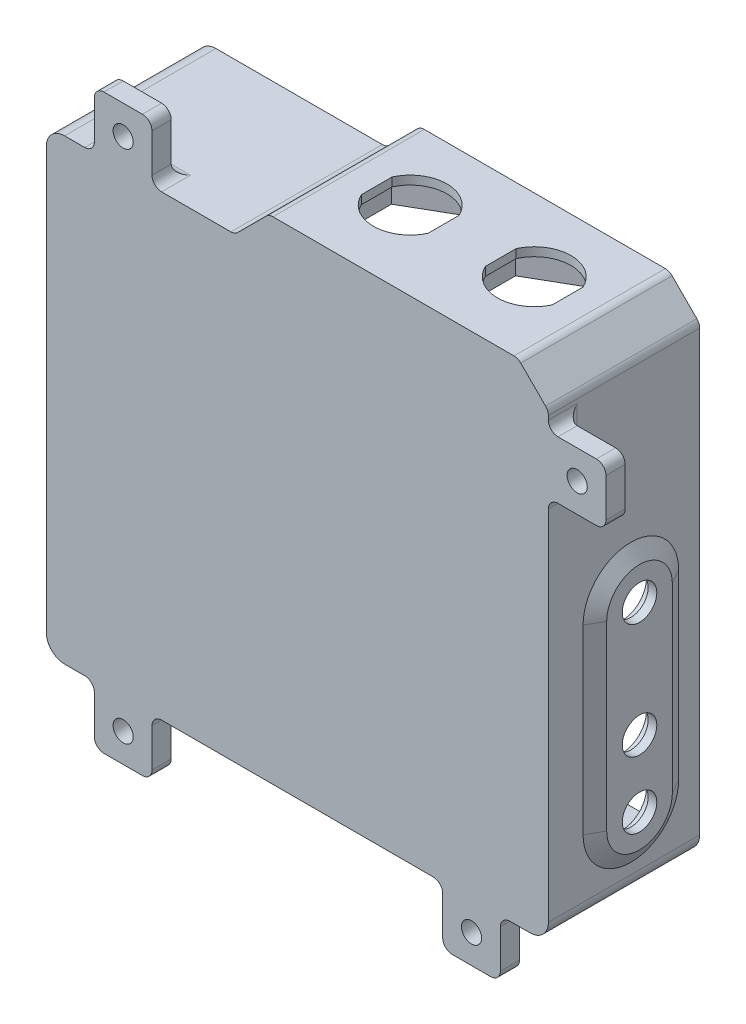
from build123d import *
from OCP.BRepFilletAPI import BRepFilletAPI_MakeChamfer

# Parameters (mm, degrees)
BOSS_EXTRUDE1_DEPTH     = 1.5
BOSS_EXTRUDE2_START     = -1.5
BOSS_EXTRUDE2_DEPTH     = 1.5
FILLET1_R               = 2
BOSS_EXTRUDE3_DEPTH     = 30
SKETCH5_R               = 5.032
SKETCH5_R_2             = 4.832
CUT_EXTRUDE1_DEPTH      = 10
BOSS_EXTRUDE4_START     = 1.8
SKETCH6_R               = 5.032
SKETCH6_R_2             = 3.597
BOSS_EXTRUDE4_DEPTH     = 1.8
CHAMFER1_SIZE           = 3.117691454
CHAMFER1_SIZE_2         = 1.8
CUT_EXTRUDE2_DEPTH      = 11.8
BOSS_EXTRUDE5_OUTLINE_W = 50.173145751
BOSS_EXTRUDE5_OUTLINE_H = 30
BOSS_EXTRUDE5_DEPTH     = 5.3
BOSS_EXTRUDE6_START     = -30
BOSS_EXTRUDE6_DEPTH     = 30
FILLET2_R               = 2
SKETCH10_R              = 2.85
SKETCH10_R_2            = 1.5
BOSS_EXTRUDE7_DEPTH     = 9
CHAMFER2_SIZE           = 2
SKETCH11_R              = 2.85
SKETCH11_R_2            = 1.5
BOSS_EXTRUDE8_DEPTH     = 30
FILLET3_R               = 2
SKETCH12_W              = 12
SKETCH12_H              = 12
SKETCH12_R              = 2.1
BOSS_EXTRUDE9_DEPTH     = 4
FILLET4_R               = 2
FILLET5_R               = 2


# Read off the part's stored shape, not the designer's step: Boss-Extrude5
# Some blends are built 0.0001 mm under size
with BuildPart() as part:
    # Sketch1 → Boss-Extrude1 (new body)
    with BuildSketch(Plane.XY):
        with BuildLine():
            Line((-71.515147012, 38.673979945), (-31.595147012, 38.673979945))
            Line((-31.595147012, 38.673979945), (25.404852988, 38.673979945))
            ThreePointArc((25.404852988, 38.673979945), (28.091858756, 37.560985714), (29.204852988, 34.873979945))
            Line((29.204852988, 34.873979945), (29.204852988, -31.776020055))
            Line((29.204852988, -31.776020055), (29.204852988, -46.156020055))
            Line((29.204852988, -46.156020055), (29.204852988, -52.766020055))
            ThreePointArc((29.204852988, -52.766020055), (28.091858756, -55.453025824), (25.404852988, -56.566020055))
            Line((25.404852988, -56.566020055), (-31.595147012, -56.566020055))
            Line((-31.595147012, -56.566020055), (-71.515147012, -56.566020055))
            ThreePointArc((-71.515147012, -56.566020055), (-74.202152781, -55.453025824), (-75.315147012, -52.766020055))
            Line((-75.315147012, -52.766020055), (-75.315147012, 34.873979945))
            ThreePointArc((-75.315147012, 34.873979945), (-74.202152781, 37.560985714), (-71.515147012, 38.673979945))
        make_face()
    extrude(amount=BOSS_EXTRUDE1_DEPTH)

    # Sketch2 → Boss-Extrude2 (add)
    with BuildSketch(Plane.XY.offset(1.5).offset(BOSS_EXTRUDE2_START)):
        Polygon((-24.958369356, 43.973979945), (-22.708369356, 43.973979945), (-22.708369356, 45.773979945), (-24.958369356, 45.773979945), (-28.958369356, 45.773979945), (-36.058369356, 38.673979945), (-24.958369356, 38.673979945), (-24.958369356, 41.673979945), align=None)
        Polygon((-22.708369356, 45.773979945), (-22.708369356, 43.973979945), (-24.958369356, 43.973979945), (-24.958369356, 41.673979945), (-24.958369356, 38.673979945), (-6.958369356, 38.673979945), (-6.958369356, 41.673979945), (-6.958369356, 43.973979945), (-9.208369356, 43.973979945), (-9.208369356, 45.773979945), align=None)
        Polygon((-6.958369356, 45.773979945), (-9.208369356, 45.773979945), (-9.208369356, 43.973979945), (-6.958369356, 43.973979945), (-6.958369356, 41.673979945), (-6.958369356, 38.673979945), (0.871630644, 38.673979945), (0.871630644, 41.673979945), (0.871630644, 43.973979945), (3.121630644, 43.973979945), (3.121630644, 45.773979945), (0.871630644, 45.773979945), align=None)
        Polygon((16.621630644, 45.773979945), (3.121630644, 45.773979945), (3.121630644, 43.973979945), (0.871630644, 43.973979945), (0.871630644, 41.673979945), (0.871630644, 38.673979945), (18.871630644, 38.673979945), (18.871630644, 41.673979945), (18.871630644, 43.973979945), (16.621630644, 43.973979945), align=None)
        with BuildLine():
            Line((18.871630644, 45.773979945), (16.621630644, 45.773979945))
            Line((16.621630644, 45.773979945), (16.621630644, 43.973979945))
            Line((16.621630644, 43.973979945), (18.871630644, 43.973979945))
            Line((18.871630644, 43.973979945), (18.871630644, 41.673979945))
            Line((18.871630644, 41.673979945), (18.871630644, 38.673979945))
            Line((18.871630644, 38.673979945), (25.404852988, 38.673979945))
            ThreePointArc((25.404852988, 38.673979945), (28.091858756, 37.560985714), (29.204852988, 34.873979945))
            Line((29.204852988, 34.873979945), (29.204852988, 39.440757601))
            Line((29.204852988, 39.440757601), (22.871630644, 45.773979945))
            Line((22.871630644, 45.773979945), (18.871630644, 45.773979945))
        make_face()
    extrude(amount=BOSS_EXTRUDE2_DEPTH)

    # Fillet1
    fillet1_edges = [part.edges().sort_by_distance(p)[0] for p in [
        (-36.058369356, 38.673979945, 0.75),
        (-28.958369356, 45.773979945, 0.75),
        (22.871630644, 45.773979945, 0.75),
        (29.204852988, 39.440757601, 0.75),
    ]]
    fillet(fillet1_edges, radius=FILLET1_R)

    # Sketch3 → Boss-Extrude3 (add)
    with BuildSketch(Plane(origin=(0, 0, 0), x_dir=(-1, 0, 0), z_dir=(0, 0, -1))):
        with BuildLine():
            Line((-29.204852988, 38.612330476), (-29.204852988, -52.766020055))
            ThreePointArc((-29.204852988, -52.766020055), (-28.091858756, -55.453025824), (-25.404852988, -56.566020055))
            Line((-25.404852988, -56.566020055), (71.515147012, -56.566020055))
            ThreePointArc((71.515147012, -56.566020055), (74.202152781, -55.453025824), (75.315147012, -52.766020055))
            Line((75.315147012, -52.766020055), (75.315147012, 34.873979945))
            ThreePointArc((75.315147012, 34.873979945), (74.202152781, 37.560985714), (71.515147012, 38.673979945))
            Line((71.515147012, 38.673979945), (36.886796481, 38.673979945))
            ThreePointArc((36.886796481, 38.673979945), (36.121429616, 38.82622088), (35.472582919, 39.259766383))
            Line((35.472582919, 39.259766383), (29.544155794, 45.188193507))
            ThreePointArc((29.544155794, 45.188193507), (28.895309096, 45.62173901), (28.129942232, 45.773979945))
            Line((28.129942232, 45.773979945), (-22.043203519, 45.773979945))
            ThreePointArc((-22.043203519, 45.773979945), (-22.808570384, 45.62173901), (-23.457417081, 45.188193507))
            Line((-23.457417081, 45.188193507), (-28.61906655, 40.026544038))
            ThreePointArc((-28.61906655, 40.026544038), (-29.052612053, 39.377697341), (-29.204852988, 38.612330476))
        make_face()
        with BuildLine():
            Line((-25.404852988, -54.766020055), (71.515147012, -54.766020055))
            ThreePointArc((71.515147012, -54.766020055), (72.929360575, -54.180233617), (73.515147012, -52.766020055))
            Line((73.515147012, -52.766020055), (73.515147012, 34.873979945))
            ThreePointArc((73.515147012, 34.873979945), (72.929360575, 36.288193507), (71.515147012, 36.873979945))
            Line((71.515147012, 36.873979945), (36.886796481, 36.873979945))
            ThreePointArc((36.886796481, 36.873979945), (35.432599438, 37.163237721), (34.199790713, 37.986974176))
            Line((34.199790713, 37.986974176), (28.271363588, 43.915401301))
            ThreePointArc((28.271363588, 43.915401301), (28.206478918, 43.958755851), (28.129942232, 43.973979945))
            Line((28.129942232, 43.973979945), (-22.043203519, 43.973979945))
            ThreePointArc((-22.043203519, 43.973979945), (-22.119740205, 43.958755851), (-22.184624875, 43.915401301))
            Line((-22.184624875, 43.915401301), (-27.346274344, 38.753751832))
            ThreePointArc((-27.346274344, 38.753751832), (-27.389628894, 38.688867163), (-27.404852988, 38.612330476))
            Line((-27.404852988, 38.612330476), (-27.404852988, -52.766020055))
            ThreePointArc((-27.404852988, -52.766020055), (-26.81906655, -54.180233617), (-25.404852988, -54.766020055))
        make_face(mode=Mode.SUBTRACT)
    extrude(amount=BOSS_EXTRUDE3_DEPTH)

    # Sketch5 → Cut-Extrude1 (cut)
    # profile 1 of 6: a face of its own
    with BuildSketch(Plane(origin=(29.204852988, 0, 0), x_dir=(0, 0, -1), z_dir=(1, 0, 0))):
        with Locations(Location((15.675, -40.576020055, 0), (0, 0, 90))):
            Circle(SKETCH5_R)
        with Locations((15.675, -40.576020055)):
            Circle(SKETCH5_R_2, mode=Mode.SUBTRACT)
    # profile 2 of 6: a face of its own
    with BuildSketch(Plane(origin=(29.204852988, 0, 0), x_dir=(0, 0, -1), z_dir=(1, 0, 0))):
        with Locations((15.675, -40.576020055)):
            Circle(SKETCH5_R_2)
    # profile 3 of 6: a face of its own
    with BuildSketch(Plane(origin=(29.204852988, 0, 0), x_dir=(0, 0, -1), z_dir=(1, 0, 0))):
        with Locations(Location((15.675, -26.676020055, 0), (0, 0, 90))):
            Circle(SKETCH5_R)
        with Locations((15.675, -26.676020055)):
            Circle(SKETCH5_R_2, mode=Mode.SUBTRACT)
    # profile 4 of 6: a face of its own
    with BuildSketch(Plane(origin=(29.204852988, 0, 0), x_dir=(0, 0, -1), z_dir=(1, 0, 0))):
        with Locations((15.675, -26.676020055)):
            Circle(SKETCH5_R_2)
    # profile 5 of 6: a face of its own
    with BuildSketch(Plane(origin=(29.204852988, 0, 0), x_dir=(0, 0, -1), z_dir=(1, 0, 0))):
        with Locations(Location((15.675, -2.776020055, 0), (0, 0, 90))):
            Circle(SKETCH5_R)
        with Locations((15.675, -2.776020055)):
            Circle(SKETCH5_R_2, mode=Mode.SUBTRACT)
    # profile 6 of 6: a face of its own
    with BuildSketch(Plane(origin=(29.204852988, 0, 0), x_dir=(0, 0, -1), z_dir=(1, 0, 0))):
        with Locations((15.675, -2.776020055)):
            Circle(SKETCH5_R_2)
    extrude(amount=-CUT_EXTRUDE1_DEPTH, mode=Mode.SUBTRACT)

    # Sketch6 → Boss-Extrude4 (add)
    # profile 1 of 4: a face of its own
    with BuildSketch(Plane(origin=(29.204852988, 0, 0), x_dir=(0, 0, -1), z_dir=(1, 0, 0)).offset(BOSS_EXTRUDE4_START)):
        with BuildLine():
            Line((8.843, -40.576020055), (8.843, -2.776020055))
            ThreePointArc((8.843, -2.776020055), (15.675, 4.055979945), (22.507, -2.776020055))
            Line((22.507, -2.776020055), (22.507, -40.576020055))
            ThreePointArc((22.507, -40.576020055), (15.675, -47.408020055), (8.843, -40.576020055))
        make_face()
        with Locations(Location((15.675, -26.676020055, 0), (0, 0, 90))):
            Circle(SKETCH6_R, mode=Mode.SUBTRACT)
        with Locations(Location((15.675, -40.576020055, 0), (0, 0, 90))):
            Circle(SKETCH6_R, mode=Mode.SUBTRACT)
        with Locations(Location((15.675, -2.776020055, 0), (0, 0, 90))):
            Circle(SKETCH6_R, mode=Mode.SUBTRACT)
    # profile 2 of 4: a face of its own
    with BuildSketch(Plane(origin=(29.204852988, 0, 0), x_dir=(0, 0, -1), z_dir=(1, 0, 0)).offset(BOSS_EXTRUDE4_START)):
        with Locations(Location((15.675, -40.576020055, 0), (0, 0, 90))):
            Circle(SKETCH6_R)
        with Locations(Location((15.675, -40.576020055, 0), (0, 0, 90))):
            Circle(SKETCH6_R_2, mode=Mode.SUBTRACT)
    # profile 3 of 4: a face of its own
    with BuildSketch(Plane(origin=(29.204852988, 0, 0), x_dir=(0, 0, -1), z_dir=(1, 0, 0)).offset(BOSS_EXTRUDE4_START)):
        with Locations(Location((15.675, -2.776020055, 0), (0, 0, 90))):
            Circle(SKETCH6_R)
        with Locations(Location((15.675, -2.776020055, 0), (0, 0, 90))):
            Circle(SKETCH6_R_2, mode=Mode.SUBTRACT)
    # profile 4 of 4: a face of its own
    with BuildSketch(Plane(origin=(29.204852988, 0, 0), x_dir=(0, 0, -1), z_dir=(1, 0, 0)).offset(BOSS_EXTRUDE4_START)):
        with Locations(Location((15.675, -26.676020055, 0), (0, 0, 90))):
            Circle(SKETCH6_R)
        with Locations(Location((15.675, -26.676020055, 0), (0, 0, 90))):
            Circle(SKETCH6_R_2, mode=Mode.SUBTRACT)
    extrude(amount=-BOSS_EXTRUDE4_DEPTH)

    # Chamfer1
    chamfer1_edges_1 = [part.edges().sort_by_distance(p)[0] for p in [
        (29.204852988, -21.676020055, -8.843),
    ]]
    chamfer1_side_1 = [part.faces().sort_by_distance(p)[0] for p in [
        (29.204852988, -21.676020055, -8.807),
    ]]
    chamfer1_edges_2 = [part.edges().sort_by_distance(p)[0] for p in [
        (29.204852988, -47.408020055, -15.675),
    ]]
    chamfer1_side_2 = [part.faces().sort_by_distance(p)[0] for p in [
        (29.204852988, -47.444020055, -15.675),
    ]]
    chamfer1_edges_3 = [part.edges().sort_by_distance(p)[0] for p in [
        (29.204852988, 4.055979945, -15.675),
    ]]
    chamfer1_side_3 = [part.faces().sort_by_distance(p)[0] for p in [
        (29.204852988, 4.091979945, -15.675),
    ]]
    chamfer1_edges_4 = [part.edges().sort_by_distance(p)[0] for p in [
        (29.204852988, -21.676020055, -22.507),
    ]]
    chamfer1_side_4 = [part.faces().sort_by_distance(p)[0] for p in [
        (29.204852988, -21.676020055, -22.543),
    ]]
    chamfer1 = BRepFilletAPI_MakeChamfer(part.part.solid().wrapped)
    for e in chamfer1_edges_1:
        chamfer1.Add(CHAMFER1_SIZE - 0.0001, CHAMFER1_SIZE_2 - 0.0001, e.wrapped, chamfer1_side_1[0].wrapped)
    for e in chamfer1_edges_2:
        chamfer1.Add(CHAMFER1_SIZE - 0.0001, CHAMFER1_SIZE_2 - 0.0001, e.wrapped, chamfer1_side_2[0].wrapped)
    for e in chamfer1_edges_3:
        chamfer1.Add(CHAMFER1_SIZE - 0.0001, CHAMFER1_SIZE_2 - 0.0001, e.wrapped, chamfer1_side_3[0].wrapped)
    for e in chamfer1_edges_4:
        chamfer1.Add(CHAMFER1_SIZE - 0.0001, CHAMFER1_SIZE_2 - 0.0001, e.wrapped, chamfer1_side_4[0].wrapped)
    add(Compound.cast(chamfer1.Shape()), mode=Mode.REPLACE)  # a hair under: the kernel refuses the full size

    # Sketch7 → Cut-Extrude2 (cut)
    # profile 1 of 4: a face of its own
    with BuildSketch(Plane(origin=(0, 45.773979945, 0), x_dir=(1, 0, 0), z_dir=(0, 1, 0))):
        with BuildLine():
            Line((-22.908369356, 14.892304845), (-22.908369356, 11.695431373))
            ThreePointArc((-22.908369356, 11.695431373), (-15.958369356, 7.242304845), (-9.008369356, 11.695431373))
            Line((-9.008369356, 11.695431373), (-9.008369356, 14.892304845))
            Line((-9.008369356, 14.892304845), (-9.008369356, 18.089178318))
            ThreePointArc((-9.008369356, 18.089178318), (-15.958369356, 22.542304845), (-22.908369356, 18.089178318))
            Line((-22.908369356, 18.089178318), (-22.908369356, 14.892304845))
        make_face()
        with BuildLine():
            ThreePointArc((-9.208369356, 18.0450814), (-15.958369356, 22.342304845), (-22.708369356, 18.0450814))
            Line((-22.708369356, 18.0450814), (-22.708369356, 14.892304845))
            Line((-22.708369356, 14.892304845), (-22.708369356, 11.739528291))
            ThreePointArc((-22.708369356, 11.739528291), (-15.958369356, 7.442304845), (-9.208369356, 11.739528291))
            Line((-9.208369356, 11.739528291), (-9.208369356, 14.892304845))
            Line((-9.208369356, 14.892304845), (-9.208369356, 18.0450814))
        make_face(mode=Mode.SUBTRACT)
    # profile 2 of 4: a face of its own
    with BuildSketch(Plane(origin=(0, 45.773979945, 0), x_dir=(1, 0, 0), z_dir=(0, 1, 0))):
        with BuildLine():
            Line((-9.208369356, 14.892304845), (-9.208369356, 18.0450814))
            ThreePointArc((-9.208369356, 18.0450814), (-15.958369356, 22.342304845), (-22.708369356, 18.0450814))
            Line((-22.708369356, 18.0450814), (-22.708369356, 14.892304845))
            Line((-22.708369356, 14.892304845), (-22.708369356, 11.739528291))
            ThreePointArc((-22.708369356, 11.739528291), (-15.958369356, 7.442304845), (-9.208369356, 11.739528291))
            Line((-9.208369356, 11.739528291), (-9.208369356, 14.892304845))
        make_face()
    # profile 3 of 4: a face of its own
    with BuildSketch(Plane(origin=(0, 45.773979945, 0), x_dir=(1, 0, 0), z_dir=(0, 1, 0))):
        with BuildLine():
            Line((2.921630644, 14.892304845), (2.921630644, 11.695431373))
            ThreePointArc((2.921630644, 11.695431373), (9.871630644, 7.242304845), (16.821630644, 11.695431373))
            Line((16.821630644, 11.695431373), (16.821630644, 14.892304845))
            Line((16.821630644, 14.892304845), (16.821630644, 18.089178318))
            ThreePointArc((16.821630644, 18.089178318), (9.871630644, 22.542304845), (2.921630644, 18.089178318))
            Line((2.921630644, 18.089178318), (2.921630644, 14.892304845))
        make_face()
        with BuildLine():
            ThreePointArc((16.621630644, 18.0450814), (9.871630644, 22.342304845), (3.121630644, 18.0450814))
            Line((3.121630644, 18.0450814), (3.121630644, 14.892304845))
            Line((3.121630644, 14.892304845), (3.121630644, 11.739528291))
            ThreePointArc((3.121630644, 11.739528291), (9.871630644, 7.442304845), (16.621630644, 11.739528291))
            Line((16.621630644, 11.739528291), (16.621630644, 14.892304845))
            Line((16.621630644, 14.892304845), (16.621630644, 18.0450814))
        make_face(mode=Mode.SUBTRACT)
    # profile 4 of 4: a face of its own
    with BuildSketch(Plane(origin=(0, 45.773979945, 0), x_dir=(1, 0, 0), z_dir=(0, 1, 0))):
        with BuildLine():
            Line((16.621630644, 14.892304845), (16.621630644, 18.0450814))
            ThreePointArc((16.621630644, 18.0450814), (9.871630644, 22.342304845), (3.121630644, 18.0450814))
            Line((3.121630644, 18.0450814), (3.121630644, 14.892304845))
            Line((3.121630644, 14.892304845), (3.121630644, 11.739528291))
            ThreePointArc((3.121630644, 11.739528291), (9.871630644, 7.442304845), (16.621630644, 11.739528291))
            Line((16.621630644, 11.739528291), (16.621630644, 14.892304845))
        make_face()
    extrude(amount=-CUT_EXTRUDE2_DEPTH, mode=Mode.SUBTRACT)

    # Boss-Extrude5 outline → Boss-Extrude5 (add)
    with BuildSketch(Plane.XZ.offset(-43.973979945)):
        with Locations((-3.043369356, -15)):
            Rectangle(BOSS_EXTRUDE5_OUTLINE_W, BOSS_EXTRUDE5_OUTLINE_H)
        Polygon((-6.758369356, -9.580682369), (-6.758369356, -20.203927322), (-15.958369356, -25.515549799), (-25.158369356, -20.203927322), (-25.158369356, -9.580682369), (-15.958369356, -4.269059892), align=None, mode=Mode.SUBTRACT)
        Polygon((19.071630644, -20.203927322), (9.871630644, -25.515549799), (0.671630644, -20.203927322), (0.671630644, -9.580682369), (9.871630644, -4.269059892), (19.071630644, -9.580682369), align=None, mode=Mode.SUBTRACT)
    extrude(amount=BOSS_EXTRUDE5_DEPTH)

    # Sketch9 → Boss-Extrude6 (add)
    with BuildSketch(Plane(origin=(0, 0, -30), x_dir=(-1, 0, 0), z_dir=(0, 0, -1)).offset(BOSS_EXTRUDE6_START)):
        with BuildLine():
            Line((-27.395114237, 38.673979945), (-22.043203519, 38.673979945))
            Line((-22.043203519, 38.673979945), (-22.043203519, 43.973979945))
            ThreePointArc((-22.043203519, 43.973979945), (-22.119740205, 43.958755851), (-22.184624875, 43.915401301))
            Line((-22.184624875, 43.915401301), (-27.346274344, 38.753751832))
            ThreePointArc((-27.346274344, 38.753751832), (-27.375423285, 38.716761189), (-27.395114237, 38.673979945))
        make_face()
        with BuildLine():
            Line((33.512784944, 38.673979945), (28.271363588, 43.915401301))
            ThreePointArc((28.271363588, 43.915401301), (28.206478918, 43.958755851), (28.129942232, 43.973979945))
            Line((28.129942232, 43.973979945), (28.129942232, 38.673979945))
            Line((28.129942232, 38.673979945), (33.512784944, 38.673979945))
        make_face()
    extrude(amount=BOSS_EXTRUDE6_DEPTH)

    # Fillet2
    fillet2_edges = [part.edges().sort_by_distance(p)[0] for p in [
        (-33.512784944, 38.673979945, -15),
        (27.395114237, 38.673979945, -15),
    ]]
    fillet(fillet2_edges, radius=FILLET2_R)

    # Sketch10 → Boss-Extrude7 (add)
    # profile 1 of 18: a face of its own
    with BuildSketch(Plane(origin=(0, 0, 0), x_dir=(-1, 0, 0), z_dir=(0, 0, -1))):
        with Locations((-18.794852988, 15.423979945)):
            Circle(SKETCH10_R)
        with Locations(Location((-18.794852988, 15.423979945, 0), (0, 0, 270))):
            Circle(SKETCH10_R_2, mode=Mode.SUBTRACT)
    # profile 2 of 18: a face of its own
    with BuildSketch(Plane(origin=(0, 0, 0), x_dir=(-1, 0, 0), z_dir=(0, 0, -1))):
        with Locations((25.985147012, 15.423979945)):
            Circle(SKETCH10_R)
        with Locations(Location((25.985147012, 15.423979945, 0), (0, 0, 270))):
            Circle(SKETCH10_R_2, mode=Mode.SUBTRACT)
    # profile 3 of 18: a face of its own
    with BuildSketch(Plane(origin=(0, 0, 0), x_dir=(-1, 0, 0), z_dir=(0, 0, -1))):
        with Locations((25.985147012, 1.043979945)):
            Circle(SKETCH10_R)
        with Locations(Location((25.985147012, 1.043979945, 0), (0, 0, 270))):
            Circle(SKETCH10_R_2, mode=Mode.SUBTRACT)
    # profile 4 of 18: a face of its own
    with BuildSketch(Plane(origin=(0, 0, 0), x_dir=(-1, 0, 0), z_dir=(0, 0, -1))):
        with Locations((-18.794852988, 1.043979945)):
            Circle(SKETCH10_R)
        with Locations(Location((-18.794852988, 1.043979945, 0), (0, 0, 270))):
            Circle(SKETCH10_R_2, mode=Mode.SUBTRACT)
    # profile 5 of 18: a face of its own
    with BuildSketch(Plane(origin=(0, 0, 0), x_dir=(-1, 0, 0), z_dir=(0, 0, -1))):
        with Locations((-18.794852988, -8.176020055)):
            Circle(SKETCH10_R)
        with Locations((-18.794852988, -8.176020055)):
            Circle(SKETCH10_R_2, mode=Mode.SUBTRACT)
    # profile 6 of 18: a face of its own
    with BuildSketch(Plane(origin=(0, 0, 0), x_dir=(-1, 0, 0), z_dir=(0, 0, -1))):
        with Locations((25.985147012, -8.176020055)):
            Circle(SKETCH10_R)
        with Locations((25.985147012, -8.176020055)):
            Circle(SKETCH10_R_2, mode=Mode.SUBTRACT)
    # profile 7 of 18: a face of its own
    with BuildSketch(Plane(origin=(0, 0, 0), x_dir=(-1, 0, 0), z_dir=(0, 0, -1))):
        with Locations((25.985147012, -22.556020055)):
            Circle(SKETCH10_R)
        with Locations((25.985147012, -22.556020055)):
            Circle(SKETCH10_R_2, mode=Mode.SUBTRACT)
    # profile 8 of 18: a face of its own
    with BuildSketch(Plane(origin=(0, 0, 0), x_dir=(-1, 0, 0), z_dir=(0, 0, -1))):
        with Locations((-18.794852988, -22.556020055)):
            Circle(SKETCH10_R)
        with Locations((-18.794852988, -22.556020055)):
            Circle(SKETCH10_R_2, mode=Mode.SUBTRACT)
    # profile 9 of 18: a face of its own
    with BuildSketch(Plane(origin=(0, 0, 0), x_dir=(-1, 0, 0), z_dir=(0, 0, -1))):
        with Locations((-18.794852988, -31.776020055)):
            Circle(SKETCH10_R)
        with Locations((-18.794852988, -31.776020055)):
            Circle(SKETCH10_R_2, mode=Mode.SUBTRACT)
    # profile 10 of 18: a face of its own
    with BuildSketch(Plane(origin=(0, 0, 0), x_dir=(-1, 0, 0), z_dir=(0, 0, -1))):
        with Locations((25.985147012, -31.776020055)):
            Circle(SKETCH10_R)
        with Locations((25.985147012, -31.776020055)):
            Circle(SKETCH10_R_2, mode=Mode.SUBTRACT)
    # profile 11 of 18: a face of its own
    with BuildSketch(Plane(origin=(0, 0, 0), x_dir=(-1, 0, 0), z_dir=(0, 0, -1))):
        with Locations((25.985147012, -46.156020055)):
            Circle(SKETCH10_R)
        with Locations((25.985147012, -46.156020055)):
            Circle(SKETCH10_R_2, mode=Mode.SUBTRACT)
    # profile 12 of 18: a face of its own
    with BuildSketch(Plane(origin=(0, 0, 0), x_dir=(-1, 0, 0), z_dir=(0, 0, -1))):
        with Locations((-18.794852988, -46.156020055)):
            Circle(SKETCH10_R)
        with Locations((-18.794852988, -46.156020055)):
            Circle(SKETCH10_R_2, mode=Mode.SUBTRACT)
    # profile 13 of 18: a face of its own
    with BuildSketch(Plane(origin=(0, 0, 0), x_dir=(-1, 0, 0), z_dir=(0, 0, -1))):
        with Locations((35.645147012, -3.706020055)):
            Circle(SKETCH10_R)
        with Locations((35.645147012, -3.706020055)):
            Circle(SKETCH10_R_2, mode=Mode.SUBTRACT)
    # profile 14 of 18: a face of its own
    with BuildSketch(Plane(origin=(0, 0, 0), x_dir=(-1, 0, 0), z_dir=(0, 0, -1))):
        with Locations((35.645147012, 24.173979945)):
            Circle(SKETCH10_R)
        with Locations((35.645147012, 24.173979945)):
            Circle(SKETCH10_R_2, mode=Mode.SUBTRACT)
    # profile 15 of 18: a face of its own
    with BuildSketch(Plane(origin=(0, 0, 0), x_dir=(-1, 0, 0), z_dir=(0, 0, -1))):
        with Locations((65.015147012, 9.643979945)):
            Circle(SKETCH10_R)
        with Locations((65.015147012, 9.643979945)):
            Circle(SKETCH10_R_2, mode=Mode.SUBTRACT)
    # profile 16 of 18: a face of its own
    with BuildSketch(Plane(origin=(0, 0, 0), x_dir=(-1, 0, 0), z_dir=(0, 0, -1))):
        with Locations((65.015147012, -18.236020055)):
            Circle(SKETCH10_R)
        with Locations((65.015147012, -18.236020055)):
            Circle(SKETCH10_R_2, mode=Mode.SUBTRACT)
    # profile 17 of 18: a face of its own
    with BuildSketch(Plane(origin=(0, 0, 0), x_dir=(-1, 0, 0), z_dir=(0, 0, -1))):
        with Locations((35.645147012, -31.586020055)):
            Circle(SKETCH10_R)
        with Locations((35.645147012, -31.586020055)):
            Circle(SKETCH10_R_2, mode=Mode.SUBTRACT)
    # profile 18 of 18: a face of its own
    with BuildSketch(Plane(origin=(0, 0, 0), x_dir=(-1, 0, 0), z_dir=(0, 0, -1))):
        with Locations((65.015147012, -46.116020055)):
            Circle(SKETCH10_R)
        with Locations((65.015147012, -46.116020055)):
            Circle(SKETCH10_R_2, mode=Mode.SUBTRACT)
    extrude(amount=BOSS_EXTRUDE7_DEPTH)

    # Chamfer2
    # the kernel refuses this chamfer: 2 mm, written as the material it adds along each edge
    with BuildSketch(Plane(origin=(18.794852988, 15.423979945, 0), x_dir=(-1, 0, 0), z_dir=(0, -1, 0))) as chamfer2_piece_1:
        Polygon((2.85 + CHAMFER2_SIZE, 0), (2.85, CHAMFER2_SIZE), (2.85, 0), align=None)
    revolve(axis=Axis((18.794852988, 15.423979945, 0), (0, 0, -1)))
    with BuildSketch(Plane(origin=(-25.985147012, 15.423979945, 0), x_dir=(-1, 0, 0), z_dir=(0, -1, 0))) as chamfer2_piece_2:
        Polygon((2.85 + CHAMFER2_SIZE, 0), (2.85, CHAMFER2_SIZE), (2.85, 0), align=None)
    revolve(axis=Axis((-25.985147012, 15.423979945, 0), (0, 0, -1)))
    with BuildSketch(Plane(origin=(-25.985147012, 1.043979945, 0), x_dir=(-1, 0, 0), z_dir=(0, -1, 0))) as chamfer2_piece_3:
        Polygon((2.85 + CHAMFER2_SIZE, 0), (2.85, CHAMFER2_SIZE), (2.85, 0), align=None)
    revolve(axis=Axis((-25.985147012, 1.043979945, 0), (0, 0, -1)))
    with BuildSketch(Plane(origin=(18.794852988, 1.043979945, 0), x_dir=(-1, 0, 0), z_dir=(0, -1, 0))) as chamfer2_piece_4:
        Polygon((2.85 + CHAMFER2_SIZE, 0), (2.85, CHAMFER2_SIZE), (2.85, 0), align=None)
    revolve(axis=Axis((18.794852988, 1.043979945, 0), (0, 0, -1)))
    with BuildSketch(Plane(origin=(18.794852988, -8.176020055, 0), x_dir=(-1, 0, 0), z_dir=(0, -1, 0))) as chamfer2_piece_5:
        Polygon((2.85 + CHAMFER2_SIZE, 0), (2.85, CHAMFER2_SIZE), (2.85, 0), align=None)
    revolve(axis=Axis((18.794852988, -8.176020055, 0), (0, 0, -1)))
    with BuildSketch(Plane(origin=(-25.985147012, -8.176020055, 0), x_dir=(-1, 0, 0), z_dir=(0, -1, 0))) as chamfer2_piece_6:
        Polygon((2.85 + CHAMFER2_SIZE, 0), (2.85, CHAMFER2_SIZE), (2.85, 0), align=None)
    revolve(axis=Axis((-25.985147012, -8.176020055, 0), (0, 0, -1)))
    with BuildSketch(Plane(origin=(-25.985147012, -22.556020055, 0), x_dir=(-1, 0, 0), z_dir=(0, -1, 0))) as chamfer2_piece_7:
        Polygon((2.85 + CHAMFER2_SIZE, 0), (2.85, CHAMFER2_SIZE), (2.85, 0), align=None)
    revolve(axis=Axis((-25.985147012, -22.556020055, 0), (0, 0, -1)))
    with BuildSketch(Plane(origin=(18.794852988, -22.556020055, 0), x_dir=(-1, 0, 0), z_dir=(0, -1, 0))) as chamfer2_piece_8:
        Polygon((2.85 + CHAMFER2_SIZE, 0), (2.85, CHAMFER2_SIZE), (2.85, 0), align=None)
    revolve(axis=Axis((18.794852988, -22.556020055, 0), (0, 0, -1)))
    with BuildSketch(Plane(origin=(18.794852988, -31.776020055, 0), x_dir=(-1, 0, 0), z_dir=(0, -1, 0))) as chamfer2_piece_9:
        Polygon((2.85 + CHAMFER2_SIZE, 0), (2.85, CHAMFER2_SIZE), (2.85, 0), align=None)
    revolve(axis=Axis((18.794852988, -31.776020055, 0), (0, 0, -1)))
    with BuildSketch(Plane(origin=(-25.985147012, -31.776020055, 0), x_dir=(-1, 0, 0), z_dir=(0, -1, 0))) as chamfer2_piece_10:
        Polygon((2.85 + CHAMFER2_SIZE, 0), (2.85, CHAMFER2_SIZE), (2.85, 0), align=None)
    revolve(axis=Axis((-25.985147012, -31.776020055, 0), (0, 0, -1)))
    with BuildSketch(Plane(origin=(-25.985147012, -46.156020055, 0), x_dir=(-1, 0, 0), z_dir=(0, -1, 0))) as chamfer2_piece_11:
        Polygon((2.85 + CHAMFER2_SIZE, 0), (2.85, CHAMFER2_SIZE), (2.85, 0), align=None)
    revolve(axis=Axis((-25.985147012, -46.156020055, 0), (0, 0, -1)))
    with BuildSketch(Plane(origin=(18.794852988, -46.156020055, 0), x_dir=(-1, 0, 0), z_dir=(0, -1, 0))) as chamfer2_piece_12:
        Polygon((2.85 + CHAMFER2_SIZE, 0), (2.85, CHAMFER2_SIZE), (2.85, 0), align=None)
    revolve(axis=Axis((18.794852988, -46.156020055, 0), (0, 0, -1)))
    with BuildSketch(Plane(origin=(-35.645147012, -3.706020055, 0), x_dir=(-1, 0, 0), z_dir=(0, -1, 0))) as chamfer2_piece_13:
        Polygon((2.85 + CHAMFER2_SIZE, 0), (2.85, CHAMFER2_SIZE), (2.85, 0), align=None)
    revolve(axis=Axis((-35.645147012, -3.706020055, 0), (0, 0, -1)))
    with BuildSketch(Plane(origin=(-35.645147012, 24.173979945, 0), x_dir=(-1, 0, 0), z_dir=(0, -1, 0))) as chamfer2_piece_14:
        Polygon((2.85 + CHAMFER2_SIZE, 0), (2.85, CHAMFER2_SIZE), (2.85, 0), align=None)
    revolve(axis=Axis((-35.645147012, 24.173979945, 0), (0, 0, -1)))
    with BuildSketch(Plane(origin=(-65.015147012, 9.643979945, 0), x_dir=(-1, 0, 0), z_dir=(0, -1, 0))) as chamfer2_piece_15:
        Polygon((2.85 + CHAMFER2_SIZE, 0), (2.85, CHAMFER2_SIZE), (2.85, 0), align=None)
    revolve(axis=Axis((-65.015147012, 9.643979945, 0), (0, 0, -1)))
    with BuildSketch(Plane(origin=(-65.015147012, -18.236020055, 0), x_dir=(-1, 0, 0), z_dir=(0, -1, 0))) as chamfer2_piece_16:
        Polygon((2.85 + CHAMFER2_SIZE, 0), (2.85, CHAMFER2_SIZE), (2.85, 0), align=None)
    revolve(axis=Axis((-65.015147012, -18.236020055, 0), (0, 0, -1)))
    with BuildSketch(Plane(origin=(-35.645147012, -31.586020055, 0), x_dir=(-1, 0, 0), z_dir=(0, -1, 0))) as chamfer2_piece_17:
        Polygon((2.85 + CHAMFER2_SIZE, 0), (2.85, CHAMFER2_SIZE), (2.85, 0), align=None)
    revolve(axis=Axis((-35.645147012, -31.586020055, 0), (0, 0, -1)))
    with BuildSketch(Plane(origin=(-65.015147012, -46.116020055, 0), x_dir=(-1, 0, 0), z_dir=(0, -1, 0))) as chamfer2_piece_18:
        Polygon((2.85 + CHAMFER2_SIZE, 0), (2.85, CHAMFER2_SIZE), (2.85, 0), align=None)
    revolve(axis=Axis((-65.015147012, -46.116020055, 0), (0, 0, -1)))

    # Sketch11 → Boss-Extrude8 (add)
    # profile 1 of 8: a face of its own
    with BuildSketch(Plane(origin=(0, 0, 0), x_dir=(-1, 0, 0), z_dir=(0, 0, -1))):
        with Locations((-25.404852988, 36.673979945)):
            Circle(SKETCH11_R)
        with Locations((-25.404852988, 36.673979945)):
            Circle(SKETCH11_R_2, mode=Mode.SUBTRACT)
    # profile 2 of 8: a face of its own
    with BuildSketch(Plane(origin=(0, 0, 0), x_dir=(-1, 0, 0), z_dir=(0, 0, -1))):
        with Locations((32.684357819, 36.673979945)):
            Circle(SKETCH11_R)
        with Locations((32.684357819, 36.673979945)):
            Circle(SKETCH11_R_2, mode=Mode.SUBTRACT)
    # profile 3 of 8: a face of its own
    with BuildSketch(Plane(origin=(0, 0, 0), x_dir=(-1, 0, 0), z_dir=(0, 0, -1))):
        with Locations((71.515147012, 34.873979945)):
            Circle(SKETCH11_R)
        with Locations((71.515147012, 34.873979945)):
            Circle(SKETCH11_R_2, mode=Mode.SUBTRACT)
    # profile 4 of 8: a face of its own
    with BuildSketch(Plane(origin=(0, 0, 0), x_dir=(-1, 0, 0), z_dir=(0, 0, -1))):
        with Locations((71.515147012, -8.946020055)):
            Circle(SKETCH11_R)
        with Locations((71.515147012, -8.946020055)):
            Circle(SKETCH11_R_2, mode=Mode.SUBTRACT)
    # profile 5 of 8: a face of its own
    with BuildSketch(Plane(origin=(0, 0, 0), x_dir=(-1, 0, 0), z_dir=(0, 0, -1))):
        with Locations((71.515147012, -52.766020055)):
            Circle(SKETCH11_R)
        with Locations((71.515147012, -52.766020055)):
            Circle(SKETCH11_R_2, mode=Mode.SUBTRACT)
    # profile 6 of 8: a face of its own
    with BuildSketch(Plane(origin=(0, 0, 0), x_dir=(-1, 0, 0), z_dir=(0, 0, -1))):
        with Locations((23.055147012, -52.766020055)):
            Circle(SKETCH11_R)
        with Locations((23.055147012, -52.766020055)):
            Circle(SKETCH11_R_2, mode=Mode.SUBTRACT)
    # profile 7 of 8: a face of its own
    with BuildSketch(Plane(origin=(0, 0, 0), x_dir=(-1, 0, 0), z_dir=(0, 0, -1))):
        with Locations((-25.404852988, -52.766020055)):
            Circle(SKETCH11_R)
        with Locations((-25.404852988, -52.766020055)):
            Circle(SKETCH11_R_2, mode=Mode.SUBTRACT)
    # profile 8 of 8: a face of its own
    with BuildSketch(Plane(origin=(0, 0, 0), x_dir=(-1, 0, 0), z_dir=(0, 0, -1))):
        with Locations((-25.404852988, -15.884660039)):
            Circle(SKETCH11_R)
        with Locations((-25.404852988, -15.884660039)):
            Circle(SKETCH11_R_2, mode=Mode.SUBTRACT)
    extrude(amount=BOSS_EXTRUDE8_DEPTH)

    # Fillet3
    fillet3_edges = [part.edges().sort_by_distance(p)[0] for p in [
        (-35.496415588, 37.137478712, -15),
        (-30.653963769, 38.673979945, -15),
        (-69.484752962, 36.873979945, -15),
        (-73.515147012, 32.843585895, -15),
        (-73.515147012, -10.976414105, -15),
        (-73.515147012, -6.915626005, -15),
        (-73.515147012, -50.735626005, -15),
        (-69.484752962, -54.766020055, -15),
        (-25.085541063, -54.766020055, -15),
        (-21.024752962, -54.766020055, -15),
        (27.404852988, -50.735626005, -15),
        (23.374458937, -54.766020055, -15),
        (27.404852988, -17.91505409, -15),
        (27.404852988, -13.854265989, -15),
        (27.404852988, 34.643585895, -15),
        (23.374458937, 38.673979945, -15),
    ]]
    fillet(fillet3_edges, radius=FILLET3_R)

    # Sketch12 → Boss-Extrude9 (add)
    # profile 1 of 4: a face of its own
    with BuildSketch(Plane.XY.offset(1.5)):
        with Locations((-59.315147012, 44.673979945)):
            Rectangle(SKETCH12_W, SKETCH12_H)
        with Locations((-59.315147012, 44.673979945)):
            Circle(SKETCH12_R, mode=Mode.SUBTRACT)
    # profile 2 of 4: a face of its own
    with BuildSketch(Plane.XY.offset(1.5)):
        with Locations((-59.315147012, -62.566020055)):
            Rectangle(SKETCH12_W, SKETCH12_H)
        with Locations((-59.315147012, -62.566020055)):
            Circle(SKETCH12_R, mode=Mode.SUBTRACT)
    # profile 3 of 4: a face of its own
    with BuildSketch(Plane.XY.offset(1.5)):
        with Locations((13.204852988, -62.566020055)):
            Rectangle(SKETCH12_W, SKETCH12_H)
        with Locations((13.204852988, -62.566020055)):
            Circle(SKETCH12_R, mode=Mode.SUBTRACT)
    # profile 4 of 4: a face of its own
    with BuildSketch(Plane.XY.offset(1.5)):
        with Locations((35.204852988, 29.773979945)):
            Rectangle(SKETCH12_W, SKETCH12_H)
        with Locations((35.204852988, 29.773979945)):
            Circle(SKETCH12_R, mode=Mode.SUBTRACT)
    extrude(amount=-BOSS_EXTRUDE9_DEPTH)

    # Fillet4
    fillet4_edges = [part.edges().sort_by_distance(p)[0] for p in [
        (-53.315147012, 38.673979945, -0.5),
        (-65.315147012, 38.673979945, -0.5),
        (-59.315147012, 38.673979945, -2.5),
        (-65.315147012, -56.566020055, -0.5),
        (-53.315147012, -56.566020055, -0.5),
        (-59.315147012, -56.566020055, -2.5),
        (7.204852988, -56.566020055, -0.5),
        (19.204852988, -56.566020055, -0.5),
        (13.204852988, -56.566020055, -2.5),
        (29.204852988, 23.773979945, -0.5),
        (29.204852988, 35.773979945, -0.5),
        (29.204852988, 29.773979945, -2.5),
    ]]
    fillet(fillet4_edges, radius=FILLET4_R)

    # Fillet5
    fillet5_edges = [part.edges().sort_by_distance(p)[0] for p in [
        (-53.315147012, 50.673979945, -0.5),
        (-65.315147012, 50.673979945, -0.5),
        (-53.315147012, -68.566020055, -0.5),
        (-65.315147012, -68.566020055, -0.5),
        (7.204852988, -68.566020055, -0.5),
        (19.204852988, -68.566020055, -0.5),
        (41.204852988, 23.773979945, -0.5),
        (41.204852988, 35.773979945, -0.5),
    ]]
    fillet(fillet5_edges, radius=FILLET5_R)


solid = part.part
